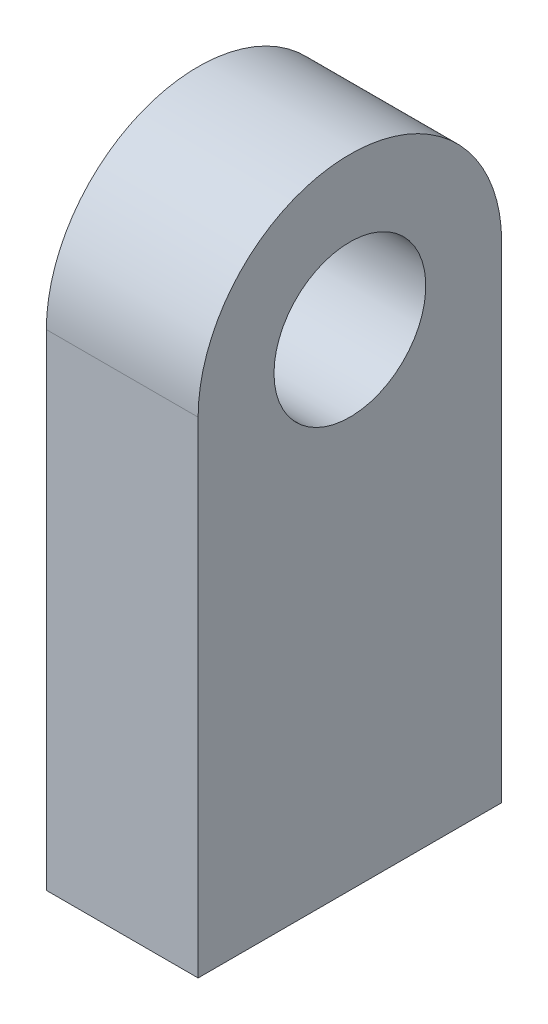
from build123d import *

# Parameters (mm, degrees)
BOSS_EXTRUDE1_DEPTH        = 10
F_10_0MM_DOWEL_HOLE1_D     = 10
F_10_0MM_DOWEL_HOLE1_DEPTH = 25
F_10_0MM_DOWEL_HOLE1_TIP   = 3.004303095


with BuildPart() as part:
    # Sketch1 → Boss-Extrude1 (new body)
    with BuildSketch(Plane(origin=(0, 0, 0), x_dir=(0, 0, -1), z_dir=(1, 0, 0))):
        with BuildLine():
            Line((10, 0), (-10, 0))
            Line((-10, 0), (-10, 32))
            ThreePointArc((-10, 32), (0, 42), (10, 32))
            Line((10, 32), (10, 0))
        make_face()
    extrude(amount=BOSS_EXTRUDE1_DEPTH)

    # Ø10.0mm Dowel Hole1
    with Locations(Plane(origin=(0, 32, 0), x_dir=(0, 0, -1), z_dir=(-1, 0, 0))):
        with Locations((0, 0)):
            Hole(F_10_0MM_DOWEL_HOLE1_D / 2, depth=F_10_0MM_DOWEL_HOLE1_DEPTH)
            with Locations((0, 0, -(F_10_0MM_DOWEL_HOLE1_DEPTH + F_10_0MM_DOWEL_HOLE1_TIP / 2))):  # 118° drill point
                Cone(0, F_10_0MM_DOWEL_HOLE1_D / 2, F_10_0MM_DOWEL_HOLE1_TIP, mode=Mode.SUBTRACT)


solid = part.part
